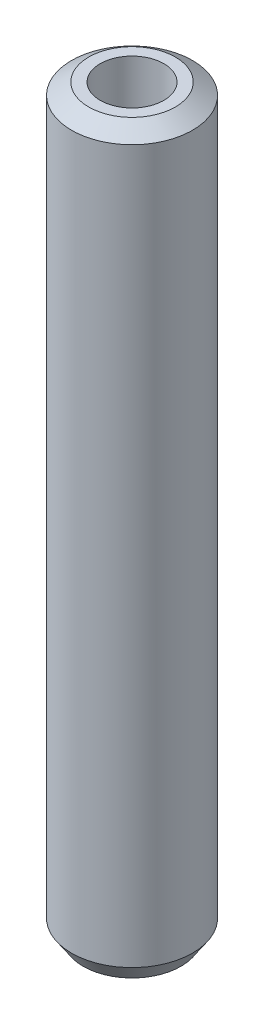
from build123d import *
from OCP.BRepFilletAPI import BRepFilletAPI_MakeChamfer

# Parameters (mm, degrees)
SKETCH1_R           = 20
BOSS_EXTRUDE1_DEPTH = 245.064112155
SKETCH2_R           = 10.52393312
CUT_EXTRUDE1_DEPTH  = 247.690938355
CHAMFER1_SIZE       = 3.815483382
CHAMFER1_SIZE2      = 5.683504446


with BuildPart() as part:
    # Sketch1 → Boss-Extrude1 (new body)
    with BuildSketch(Plane(origin=(0, 0, 0), x_dir=(1, 0, 0), z_dir=(0, 1, 0))):
        Circle(SKETCH1_R)
    extrude(amount=BOSS_EXTRUDE1_DEPTH)

    # Sketch2 → Cut-Extrude1 (cut, through all)
    with BuildSketch(Plane(origin=(0, 0, 0), x_dir=(1, 0, 0), z_dir=(0, 1, 0))):
        Circle(SKETCH2_R)
    extrude(amount=CUT_EXTRUDE1_DEPTH, mode=Mode.SUBTRACT)

    # Chamfer1: one chamfer whose edges measure the first distance from different faces: ONE call of the kernel's chamfer builder (chamfer() names one face for all edges)
    chamfer1_edges_1 = [part.edges().sort_by_distance(p)[0] for p in [
        (-20, 245.064112155, 0),
    ]]
    chamfer1_side_1 = [part.faces().sort_by_distance(p)[0] for p in [
        (-20, 122.532056078, 0),
    ]]
    chamfer1_edges_2 = [part.edges().sort_by_distance(p)[0] for p in [
        (-20, 0, 0),
    ]]
    chamfer1_side_2 = [part.faces().sort_by_distance(p)[0] for p in [
        (-19.434314575, 0, 0),
    ]]
    chamfer1 = BRepFilletAPI_MakeChamfer(part.part.solid().wrapped)
    for e in chamfer1_edges_1:
        chamfer1.Add(CHAMFER1_SIZE, CHAMFER1_SIZE2, e.wrapped, chamfer1_side_1[0].wrapped)  # the first distance lies on this face
    for e in chamfer1_edges_2:
        chamfer1.Add(CHAMFER1_SIZE, CHAMFER1_SIZE2, e.wrapped, chamfer1_side_2[0].wrapped)  # the first distance lies on this face
    add(Compound.cast(chamfer1.Shape()), mode=Mode.REPLACE)


solid = part.part
